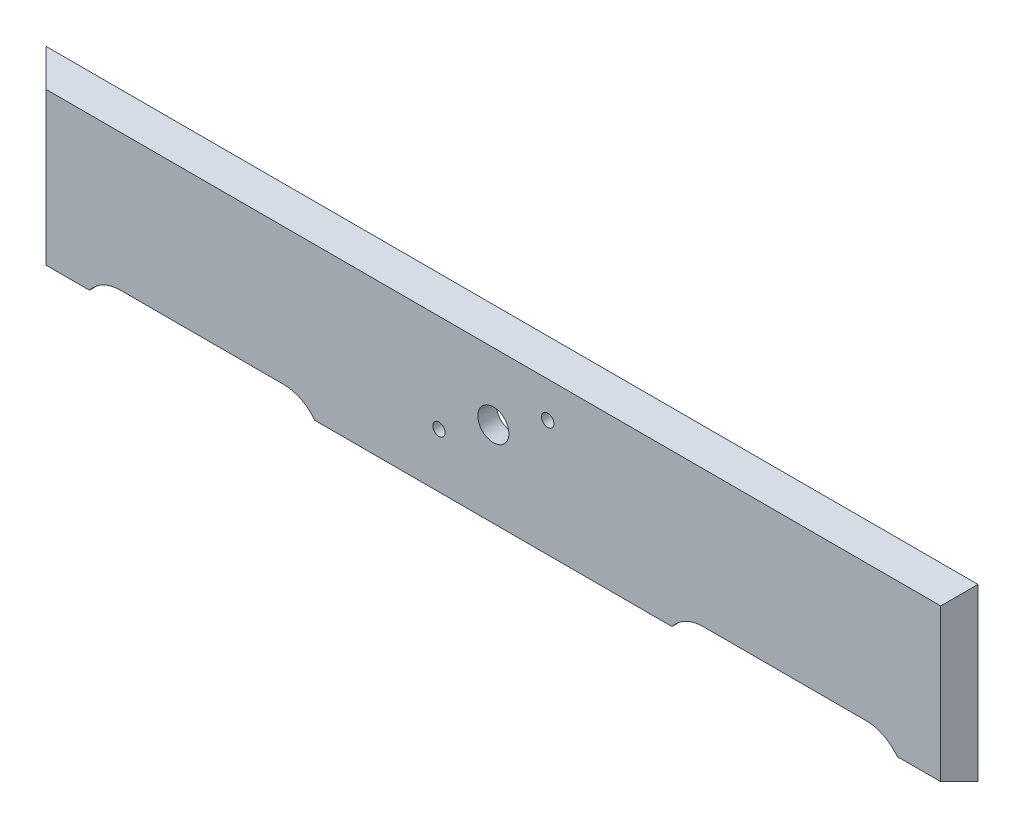
from build123d import *

# Parameters (mm, degrees)
BOSS_EXTRUDE1_DEPTH = 12
CHAMFER1_SIZE       = 12
SKETCH2_R           = 4
SKETCH2_R_2         = 10
CUT_EXTRUDE1_DEPTH  = 609.394608786


with BuildPart() as part:
    # Sketch1 → Boss-Extrude1 (new body)
    with BuildSketch(Plane.XY):
        with BuildLine():
            Line((0, 0), (0, -10))
            Line((0, -10), (40, -10))
            ThreePointArc((40, -10), (48.819660113, -2.639320225), (60, 0))
            Line((60, 0), (165, 0))
            ThreePointArc((165, 0), (176.180339887, -2.639320225), (185, -10))
            Line((185, -10), (415, -10))
            ThreePointArc((415, -10), (423.819660113, -2.639320225), (435, 0))
            Line((435, 0), (540, 0))
            ThreePointArc((540, 0), (551.180339887, -2.639320225), (560, -10))
            Line((560, -10), (600, -10))
            Line((600, -10), (600, 0))
            Line((600, 0), (600, 100))
            Line((600, 100), (0, 100))
            Line((0, 100), (0, 0))
        make_face()
    extrude(amount=BOSS_EXTRUDE1_DEPTH)

    # Chamfer1
    chamfer1_edges = [part.edges().sort_by_distance(p)[0] for p in [
        (300, 100, 12),
        (600, 45, 12),
        (0, 45, 12),
    ]]
    chamfer(chamfer1_edges, length=CHAMFER1_SIZE - 0.0001)  # a hair under: the kernel refuses the full size

    # Sketch2 → Cut-Extrude1 (cut, through all)
    with BuildSketch(Plane(origin=(0, 0, 0), x_dir=(-1, 0, 0), z_dir=(0, 0, -1))):
        with Locations((-335, 65)):
            Circle(SKETCH2_R)
        with Locations((-300, 45)):
            Circle(SKETCH2_R_2)
        with Locations((-265, 25)):
            Circle(SKETCH2_R)
    extrude(amount=-CUT_EXTRUDE1_DEPTH, mode=Mode.SUBTRACT)


solid = part.part
